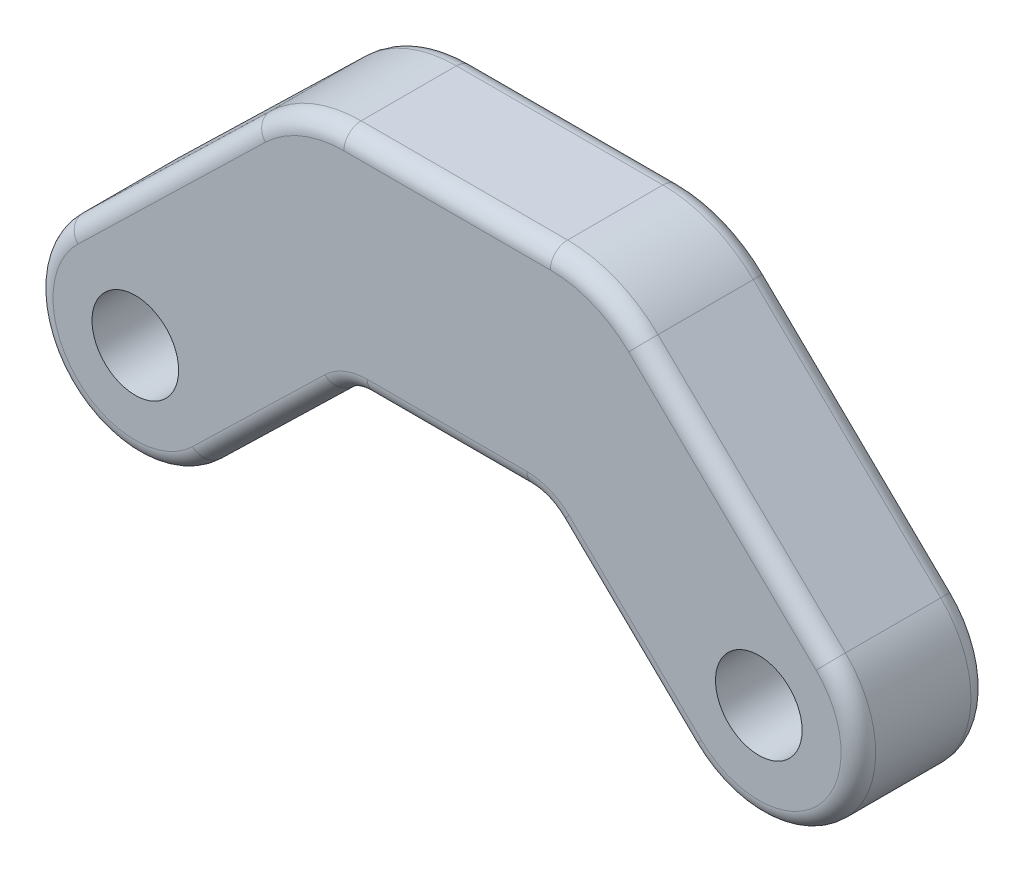
from build123d import *

# Parameters (mm, degrees)
BASE_EXTRUDE_DEPTH = 15
HOLE1_OUTLINE_R    = 5
HOLE1_DEPTH        = 15
HOLE2_OUTLINE_R    = 5
HOLE2_DEPTH        = 15
FILLET1_R          = 15
FILLET2_R          = 5
FILLET3_R          = 2


# Read off the part's stored shape, not the designer's step: Hole1, Hole2
with BuildPart() as part:
    # Sketch1 → Base-Extrude (new body)
    with BuildSketch(Plane.XY):
        with BuildLine():
            Line((-8.009157876, 8.252477817), (18, 33.494769435))
            Line((18, 33.494769435), (54, 33.494769435))
            Line((54, 33.494769435), (80.009157876, 8.252477817))
            ThreePointArc((80.009157876, 8.252477817), (80.252477817, -8.009157876), (63.990842124, -8.252477817))
            Line((63.990842124, -8.252477817), (47.25, 7.994769435))
            Line((47.25, 7.994769435), (24.75, 7.994769435))
            Line((24.75, 7.994769435), (8.009157876, -8.252477817))
            ThreePointArc((8.009157876, -8.252477817), (-8.252477817, -8.009157876), (-8.009157876, 8.252477817))
        make_face()
    extrude(amount=BASE_EXTRUDE_DEPTH)

    # Hole1 outline → Hole1 (cut)
    with BuildSketch(Plane.XY):
        Circle(HOLE1_OUTLINE_R)
    extrude(amount=HOLE1_DEPTH, mode=Mode.SUBTRACT)

    # Hole2 outline → Hole2 (cut)
    with BuildSketch(Plane.XY):
        with Locations((72, 0)):
            Circle(HOLE2_OUTLINE_R)
    extrude(amount=HOLE2_DEPTH, mode=Mode.SUBTRACT)

    # Fillet1
    fillet1_edges = [part.edges().sort_by_distance(p)[0] for p in [
        (18, 33.494769435, 7.5),
        (54, 33.494769435, 7.5),
    ]]
    fillet(fillet1_edges, radius=FILLET1_R)

    # Fillet2
    fillet2_edges = [part.edges().sort_by_distance(p)[0] for p in [
        (47.25, 7.994769435, 7.5),
        (24.75, 7.994769435, 7.5),
    ]]
    fillet(fillet2_edges, radius=FILLET2_R)

    # Fillet3
    fillet3_edges = [part.edges().sort_by_distance(p)[0] for p in [
        (15.652147936, -0.834837274, 0),
        (-8.252477817, -8.009157876, 0),
        (80.252477817, -8.009157876, 15),
        (2.813128058, 18.755674377, 15),
        (36, 33.494769435, 0),
        (36, 33.494769435, 15),
        (69.186871942, 18.755674377, 0),
        (18.445720917, 32.395516223, 0),
        (53.554279083, 32.395516223, 0),
        (69.186871942, 18.755674377, 15),
        (18.445720917, 32.395516223, 15),
        (53.554279083, 32.395516223, 15),
        (-8.252477817, -8.009157876, 15),
        (36, 7.994769435, 0),
        (36, 7.994769435, 15),
        (56.347852064, -0.834837274, 0),
        (56.347852064, -0.834837274, 15),
        (24.898573639, 7.628351698, 0),
        (24.898573639, 7.628351698, 15),
        (47.101426361, 7.628351698, 0),
        (47.101426361, 7.628351698, 15),
        (15.652147936, -0.834837274, 15),
        (2.813128058, 18.755674377, 0),
        (80.252477817, -8.009157876, 0),
    ]]
    fillet(fillet3_edges, radius=FILLET3_R)


solid = part.part
